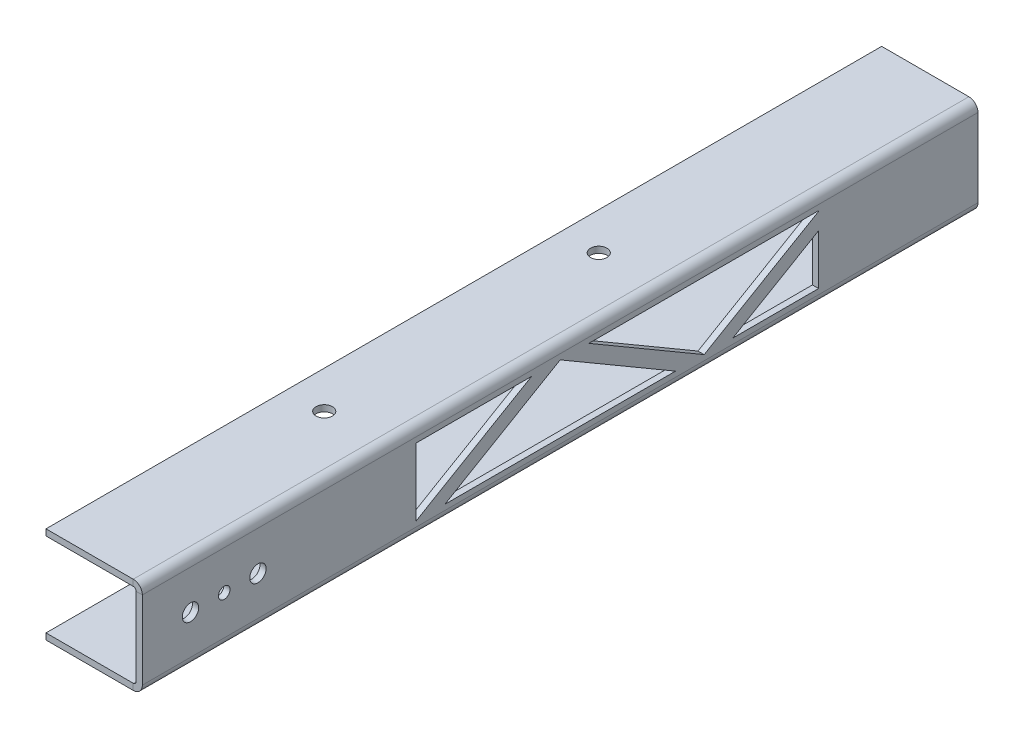
from build123d import *

# Parameters (mm, degrees)
SKETCH1_W                = 20
SKETCH1_H                = 20
BOSS_EXTRUDE1_DEPTH      = 173.5
CONVERT_SOLID1_DEPTH     = 173.5
CUT_EXTRUDE2_DEPTH       = 10
SKETCH15_W               = 56.851586871
SKETCH15_H               = 15.11
BOSS_EXTRUDE2_DEPTH      = 1.29
M3_CLEARANCE_HOLE1_D     = 3.4
M3_CLEARANCE_HOLE1_DEPTH = 3.34
M3_CLEARANCE_HOLE1_TIP   = 1.021463052
SKETCH20_R               = 1.2
CUT_EXTRUDE5_DEPTH       = 5
M3_CLEARANCE_HOLE2_D     = 3.4
SKETCH35_W               = 33.08369384
SKETCH35_H               = 16.22
BOSS_EXTRUDE3_DEPTH      = 1.29


# Read off the part's stored shape, not the designer's step: Convert-Solid1
with BuildPart() as part:
    # Sketch1 → Boss-Extrude1 (new body)
    with BuildSketch(Plane.XY):
        with Locations((10, 10)):
            Rectangle(SKETCH1_W, SKETCH1_H)
    extrude(amount=BOSS_EXTRUDE1_DEPTH)

    # Convert-Solid1 outline → Convert-Solid1 (cut)
    with BuildSketch(Plane.XY):
        with BuildLine():
            Line((20, 0), (20, 1.89))
            ThreePointArc((20, 1.89), (19.446431816, 0.553568184), (18.11, 0))
            Line((18.11, 0), (20, 0))
        make_face()
        with BuildLine():
            ThreePointArc((18.11, 20), (19.446431816, 19.446431816), (20, 18.11))
            Line((20, 18.11), (20, 20))
            Line((20, 20), (18.11, 20))
        make_face()
        with BuildLine():
            Line((0, 18.71), (0, 1.29))
            Line((0, 1.29), (18.11, 1.29))
            ThreePointArc((18.11, 1.29), (18.534264069, 1.465735931), (18.71, 1.89))
            Line((18.71, 1.89), (18.71, 18.11))
            ThreePointArc((18.71, 18.11), (18.534264069, 18.534264069), (18.11, 18.71))
            Line((18.11, 18.71), (0, 18.71))
        make_face()
    extrude(amount=CONVERT_SOLID1_DEPTH, mode=Mode.SUBTRACT)

    # Sketch3 → Cut-Extrude2 (cut)
    with BuildSketch(Plane(origin=(20, 0, 0), x_dir=(0, 0, -1), z_dir=(1, 0, 0))):
        Polygon((-86.75, 17), (-62.796826259, 3), (-110.703173741, 3), align=None)
        Polygon((-80.804760612, 17), (-56.851586871, 3), (-32.898413129, 17), align=None)
        Polygon((-50.906347483, 3), (-26.953173741, 17), (-3, 3), align=None)
        Polygon((-21.007934353, 17), (-3, 6.474836042), (-3, 17), align=None)
        Polygon((-170.5, 17), (-152.492065647, 17), (-170.5, 6.474836042), align=None)
        Polygon((-170.5, 3), (-122.593652517, 3), (-146.546826259, 17), align=None)
        Polygon((-140.601586871, 17), (-92.695239388, 17), (-116.648413129, 3), align=None)
    extrude(amount=-CUT_EXTRUDE2_DEPTH, mode=Mode.SUBTRACT)

    # Sketch15 → Boss-Extrude2 (add)
    with BuildSketch(Plane(origin=(20, 0, 0), x_dir=(0, 0, -1), z_dir=(1, 0, 0))):
        with Locations((-145.074206565, 9.445)):
            Rectangle(SKETCH15_W, SKETCH15_H)
    extrude(amount=-BOSS_EXTRUDE2_DEPTH)

    # M3 Clearance Hole1
    with Locations(Plane.ZY.offset(-18.71)):
        with Locations((163.5, 10), (149.5, 10)):
            Hole(M3_CLEARANCE_HOLE1_D / 2, depth=M3_CLEARANCE_HOLE1_DEPTH)
            with Locations((0, 0, -(M3_CLEARANCE_HOLE1_DEPTH + M3_CLEARANCE_HOLE1_TIP / 2))):  # 118° drill point
                Cone(0, M3_CLEARANCE_HOLE1_D / 2, M3_CLEARANCE_HOLE1_TIP, mode=Mode.SUBTRACT)

    # Sketch20 → Cut-Extrude5 (cut)
    with BuildSketch(Plane.ZY.offset(-18.71)):
        with Locations(Location((156.5, 10, 0), (0, 0, 270))):
            Circle(SKETCH20_R)
    extrude(amount=-CUT_EXTRUDE5_DEPTH, mode=Mode.SUBTRACT)

    # M3 Clearance Hole2 (through all)
    with Locations(Plane(origin=(85.70162808, 20, 101.952320986), x_dir=(0, 0, -1), z_dir=(0, 1, 0))):
        with Locations((-21.547679014, 77.93962808), (35.452320986, 77.93962808)):
            Hole(M3_CLEARANCE_HOLE2_D / 2)

    # Sketch35 → Boss-Extrude3 (add)
    with BuildSketch(Plane(origin=(20, 0, 0), x_dir=(0, 0, -1), z_dir=(1, 0, 0))):
        with Locations((-16.54184692, 10)):
            Rectangle(SKETCH35_W, SKETCH35_H)
    extrude(amount=-BOSS_EXTRUDE3_DEPTH)


solid = part.part
